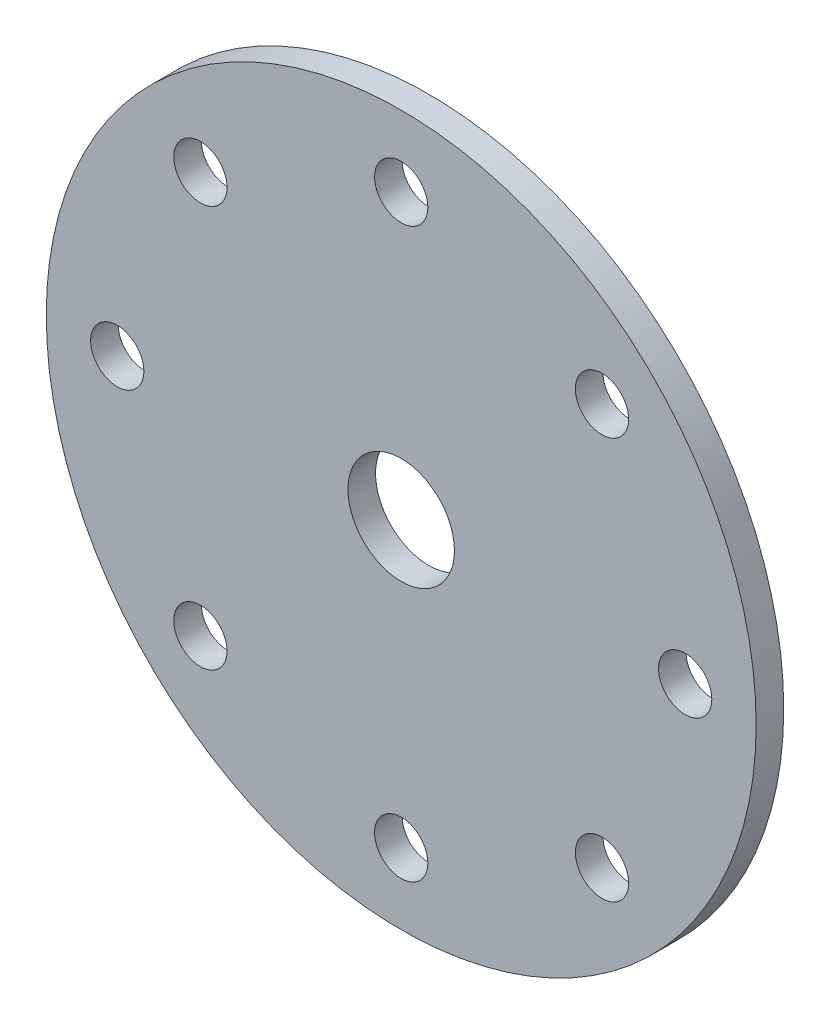
from build123d import *

# Parameters (mm, degrees)
SKETCH1_R        = 63.5
SKETCH1_R_2      = 4.7625
SKETCH1_R_3      = 9.525
ROTOR_DISC_DEPTH = 4.93522


with BuildPart() as part:
    # Sketch1 → Rotor Disc (new body)
    with BuildSketch(Plane.XY):
        Circle(SKETCH1_R)
        with Locations((-35.921024484, -35.921024484)):
            Circle(SKETCH1_R_2, mode=Mode.SUBTRACT)
        with Locations((-50.8, 0)):
            Circle(SKETCH1_R_2, mode=Mode.SUBTRACT)
        with Locations((0, -50.8)):
            Circle(SKETCH1_R_2, mode=Mode.SUBTRACT)
        with Locations((35.921024484, -35.921024484)):
            Circle(SKETCH1_R_2, mode=Mode.SUBTRACT)
        with Locations((-35.921024484, 35.921024484)):
            Circle(SKETCH1_R_2, mode=Mode.SUBTRACT)
        Circle(SKETCH1_R_3, mode=Mode.SUBTRACT)
        with Locations((50.8, 0)):
            Circle(SKETCH1_R_2, mode=Mode.SUBTRACT)
        with Locations((0, 50.8)):
            Circle(SKETCH1_R_2, mode=Mode.SUBTRACT)
        with Locations((35.921024484, 35.921024484)):
            Circle(SKETCH1_R_2, mode=Mode.SUBTRACT)
    extrude(amount=ROTOR_DISC_DEPTH)


solid = part.part
